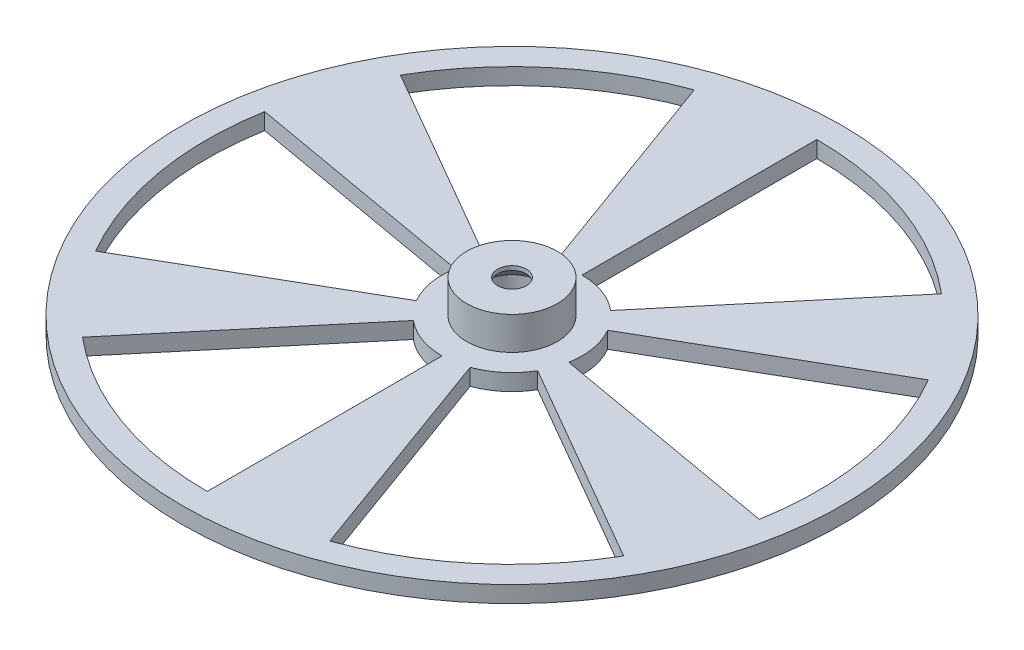
from build123d import *

# Parameters (mm, degrees)
CROQUIS1_R              = 40
SALIENTE_EXTRUIR1_DEPTH = 2
CROQUIS2_R              = 5.5
SALIENTE_EXTRUIR2_DEPTH = 4
CROQUIS3_R              = 1.75
CORTAR_EXTRUIR1_DEPTH   = 57.885850613
CROQUIS4_R              = 3.25
CORTAR_EXTRUIR2_DEPTH   = 3.5
CHAFL_N1_SIZE           = 2
CORTAR_EXTRUIR3_DEPTH   = 57.709787515


with BuildPart() as part:
    # Croquis1 → Saliente-Extruir1 (new body)
    with BuildSketch(Plane(origin=(0, 0, 0), x_dir=(1, 0, 0), z_dir=(0, 1, 0))):
        with Locations(Location((0, 0, 0), (0, 0, 270))):
            Circle(CROQUIS1_R)
    extrude(amount=SALIENTE_EXTRUIR1_DEPTH)

    # Croquis2 → Saliente-Extruir2 (add)
    with BuildSketch(Plane(origin=(0, 2, 0), x_dir=(1, 0, 0), z_dir=(0, 1, 0))):
        with Locations(Location((0, 0, 0), (0, 0, 270))):
            Circle(CROQUIS2_R)
    extrude(amount=SALIENTE_EXTRUIR2_DEPTH)

    # Croquis3 → Cortar-Extruir1 (cut, through all)
    with BuildSketch(Plane(origin=(0, 6, 0), x_dir=(1, 0, 0), z_dir=(0, 1, 0))):
        with Locations(Location((0, 0, 0), (0, 0, 270))):
            Circle(CROQUIS3_R)
    extrude(amount=-CORTAR_EXTRUIR1_DEPTH, mode=Mode.SUBTRACT)

    # Croquis4 → Cortar-Extruir2 (cut)
    with BuildSketch(Plane(origin=(0, 0, 0), x_dir=(-1, 0, 0), z_dir=(0, -1, 0))):
        with Locations(Location((0, 0, 0), (0, 0, 90))):
            Circle(CROQUIS4_R)
    extrude(amount=-CORTAR_EXTRUIR2_DEPTH, mode=Mode.SUBTRACT)

    # Chaflán1
    # the kernel refuses this chamfer: 2 mm, written as the material it takes off along each edge
    with BuildSketch(Plane(origin=(0, 3.5, 0), x_dir=(0, 0, 1), z_dir=(-1, 0, 0))) as chafl_n1_piece_1_section:
        Polygon((1.75 + CHAFL_N1_SIZE, 0), (1.75, CHAFL_N1_SIZE), (1.75, 0), align=None)
    chafl_n1_piece_1 = revolve(axis=Axis((0, 3.5, 0), (0, 1, 0)), mode=Mode.PRIVATE)
    chafl_n1_piece_1 = chafl_n1_piece_1 & Plane(origin=(0, 4.756379489, 0), x_dir=(0, 0, -1), z_dir=(0, -1, 0)) * Cylinder(3.25, 15, mode=Mode.PRIVATE)
    add(chafl_n1_piece_1, mode=Mode.SUBTRACT)

    # Croquis5 → Cortar-Extruir3 (cut, through all)
    with BuildSketch(Plane(origin=(0, 2, 0), x_dir=(1, 0, 0), z_dir=(0, 1, 0))):
        with BuildLine():
            Line((0, 8.5), (0, 37))
            ThreePointArc((0, 37), (12.654745303, 34.768626969), (23.783141558, 28.343644395))
            Line((23.783141558, 28.343644395), (5.463694682, 6.511377767))
            ThreePointArc((5.463694682, 6.511377767), (2.907171218, 7.987387277), (0, 8.5))
        make_face()
        with BuildLine():
            Line((7.361215932, 4.25), (32.04293994, 18.5))
            ThreePointArc((32.04293994, 18.5), (36.437886861, 6.424982574), (36.437886861, -6.424982574))
            Line((36.437886861, -6.424982574), (8.370865901, -1.47600951))
            ThreePointArc((8.370865901, -1.47600951), (8.370865901, 1.47600951), (7.361215932, 4.25))
        make_face()
        with BuildLine():
            Line((7.361215932, -4.25), (32.04293994, -18.5))
            ThreePointArc((32.04293994, -18.5), (23.783141558, -28.343644395), (12.654745303, -34.768626969))
            Line((12.654745303, -34.768626969), (2.907171218, -7.987387277))
            ThreePointArc((2.907171218, -7.987387277), (5.463694682, -6.511377767), (7.361215932, -4.25))
        make_face()
        with BuildLine():
            Line((0, -8.5), (0, -37))
            ThreePointArc((0, -37), (-12.654745303, -34.768626969), (-23.783141558, -28.343644395))
            Line((-23.783141558, -28.343644395), (-5.463694682, -6.511377767))
            ThreePointArc((-5.463694682, -6.511377767), (-2.907171218, -7.987387277), (0, -8.5))
        make_face()
        with BuildLine():
            Line((-7.361215932, -4.25), (-32.04293994, -18.5))
            ThreePointArc((-32.04293994, -18.5), (-36.437886861, -6.424982574), (-36.437886861, 6.424982574))
            Line((-36.437886861, 6.424982574), (-8.370865901, 1.47600951))
            ThreePointArc((-8.370865901, 1.47600951), (-8.370865901, -1.47600951), (-7.361215932, -4.25))
        make_face()
        with BuildLine():
            Line((-7.361215932, 4.25), (-32.04293994, 18.5))
            ThreePointArc((-32.04293994, 18.5), (-23.783141558, 28.343644395), (-12.654745303, 34.768626969))
            Line((-12.654745303, 34.768626969), (-2.907171218, 7.987387277))
            ThreePointArc((-2.907171218, 7.987387277), (-5.463694682, 6.511377767), (-7.361215932, 4.25))
        make_face()
    extrude(amount=-CORTAR_EXTRUIR3_DEPTH, mode=Mode.SUBTRACT)


solid = part.part
